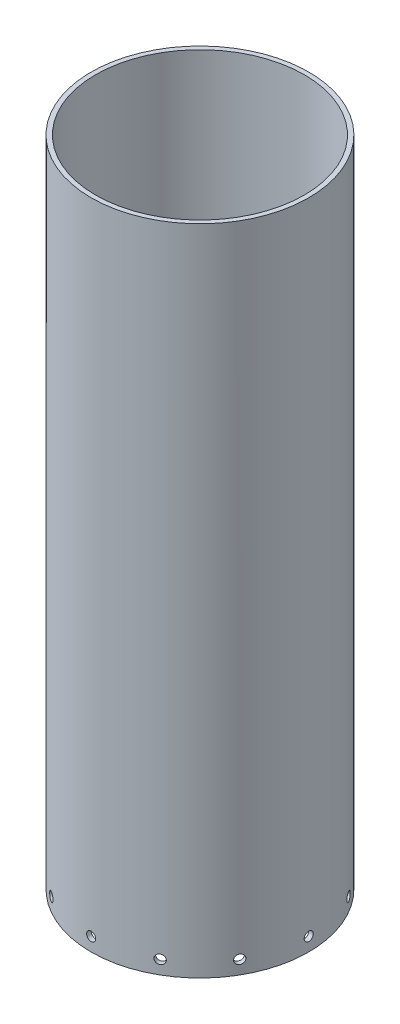
from build123d import *

# Parameters (mm, degrees)
SKETCH2_R           = 76.2
SKETCH2_R_2         = 73.025
BOSS_EXTRUDE1_DEPTH = 457.2
SKETCH3_R           = 3.175
CUT_EXTRUDE1_DEPTH  = 470.728347026
CIRPATTERN1_COUNT   = 12


with BuildPart() as part:
    # Sketch2 → Boss-Extrude1 (new body)
    with BuildSketch(Plane(origin=(0, 0, 0), x_dir=(1, 0, 0), z_dir=(0, 1, 0))):
        Circle(SKETCH2_R)
        Circle(SKETCH2_R_2, mode=Mode.SUBTRACT)
    extrude(amount=BOSS_EXTRUDE1_DEPTH)

    # Sketch3 → Cut-Extrude1 (cut, through all)
    with BuildSketch(Plane.XY):
        with Locations((0, 9.525)):
            Circle(SKETCH3_R)
    cut_extrude1 = extrude(amount=-CUT_EXTRUDE1_DEPTH, mode=Mode.SUBTRACT)

    # CirPattern1: Cut-Extrude1 ×12 about axis
    cirpattern1_axis = Axis((0, 0, 0), (0, 1, 0))
    for i in range(1, CIRPATTERN1_COUNT):
        add(cut_extrude1.rotate(cirpattern1_axis, i * 360 / CIRPATTERN1_COUNT), mode=Mode.SUBTRACT)


solid = part.part
